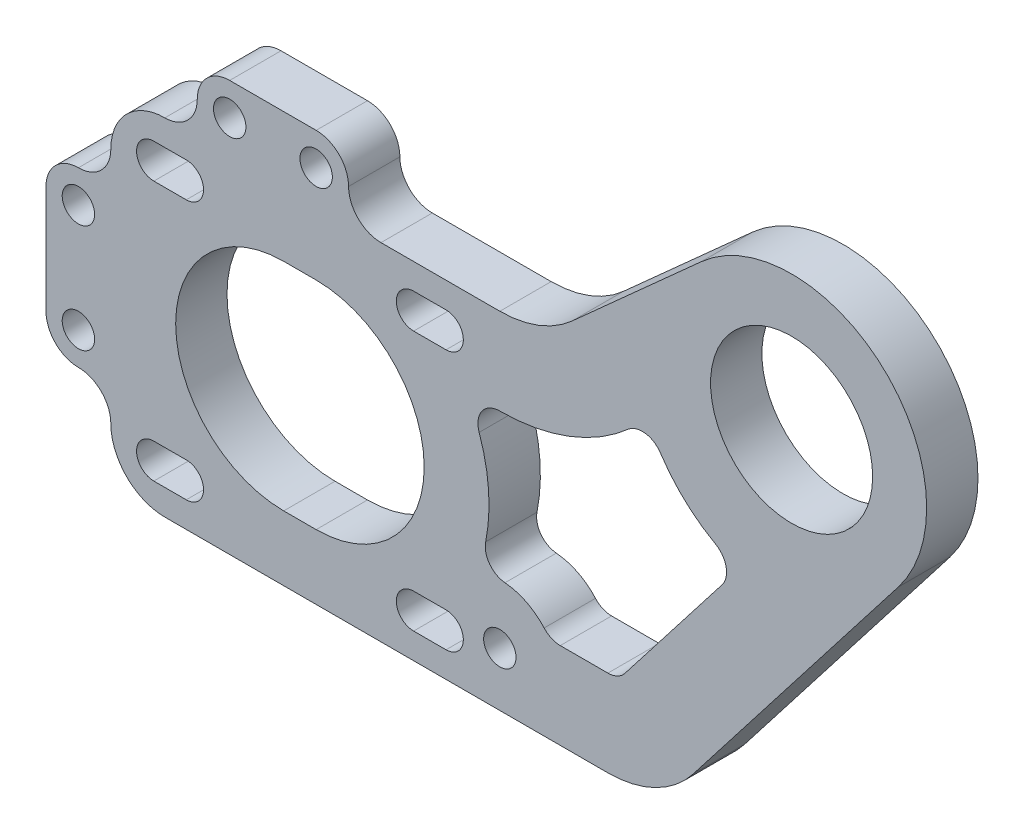
from build123d import *

# Parameters (mm, degrees)
SKETCH1_R               = 1.5
SKETCH1_R_2             = 7.5
BOSS_EXTRUDE1_DEPTH     = 2.375
CUT_EXTRUDE1_DEPTH      = 68.839078893
CUT_EXTRUDE1_DEPTH_BACK = 68.839078893


with BuildPart() as part:
    # Sketch1 → Boss-Extrude1 (new, symmetric)
    with BuildSketch(Plane.XY):
        with BuildLine():
            ThreePointArc((-11, 16), (-14.535533906, 14.535533906), (-16, 11))
            ThreePointArc((-16, 11), (-16.878679656, 8.878679656), (-19, 8))
            ThreePointArc((-19, 8), (-21.121320344, 7.121320344), (-22, 5))
            Line((-22, 5), (-22, -5))
            ThreePointArc((-22, -5), (-21.121320344, -7.121320344), (-19, -8))
            ThreePointArc((-19, -8), (-16.878679656, -8.878679656), (-16, -11))
            ThreePointArc((-16, -11), (-14.535533906, -14.535533906), (-11, -16))
            Line((-11, -16), (30, -16))
            ThreePointArc((30, -16), (34.39981922, -14.980066304), (37.902133665, -12.128318166))
            Line((37.902133665, -12.128318166), (56.877667081, 12.339602293))
            ThreePointArc((56.877667081, 12.339602293), (55.515808728, 29.150464562), (38.650559602, 29.30251821))
            Line((38.650559602, 29.30251821), (26.679552318, 18.557985432))
            ThreePointArc((26.679552318, 18.557985432), (23.576300765, 16.66136665), (20, 16))
            Line((20, 16), (9, 16))
            ThreePointArc((9, 16), (6.878679656, 16.878679656), (6, 19))
            ThreePointArc((6, 19), (5.121320344, 21.121320344), (3, 22))
            Line((3, 22), (-5, 22))
            ThreePointArc((-5, 22), (-7.121320344, 21.121320344), (-8, 19))
            ThreePointArc((-8, 19), (-8.878679656, 16.878679656), (-11, 16))
        make_face()
        with BuildLine():
            ThreePointArc((0, -10), (-10, 0), (0, 10))
            Line((0, 10), (3, 10))
            ThreePointArc((3, 10), (13, 0), (3, -10))
            Line((3, -10), (0, -10))
        make_face(mode=Mode.SUBTRACT)
        with Locations((20, -11)):
            Circle(SKETCH1_R, mode=Mode.SUBTRACT)
        with BuildLine():
            Line((40.560975696, 4.354266843), (31.580426733, -7.225663633))
            ThreePointArc((31.580426733, -7.225663633), (30.879963844, -7.796013261), (30, -8))
            Line((30, -8), (25.590169944, -8))
            ThreePointArc((25.590169944, -8), (24.773673363, -7.825741858), (24.099457959, -7.333333333))
            ThreePointArc((24.099457959, -7.333333333), (22.461292287, -6.081459538), (20.47726218, -5.520746327))
            ThreePointArc((20.47726218, -5.520746327), (19.050581882, -4.727983476), (18.689610724, -3.136258174))
            ThreePointArc((18.689610724, -3.136258174), (18.959379998, 1.139381444), (18.084944665, 5.333333333))
            ThreePointArc((18.084944665, 5.333333333), (18.337569587, 7.154700538), (19.970562748, 8))
            Line((19.970562748, 8), (20, 8))
            ThreePointArc((20, 8), (26.437341377, 9.190459971), (32.023194173, 12.604373778))
            Line((32.023194173, 12.604373778), (31.856643012, 12.454886407))
            ThreePointArc((31.856643012, 12.454886407), (33.451803609, 12.949609654), (34.866183357, 12.061455191))
            ThreePointArc((34.866183357, 12.061455191), (37.121661875, 9.385461108), (39.952603634, 7.327817691))
            ThreePointArc((39.952603634, 7.327817691), (40.93995997, 5.980815134), (40.560975696, 4.354266843))
        make_face(mode=Mode.SUBTRACT)
        with Locations((3, 19)):
            Circle(SKETCH1_R, mode=Mode.SUBTRACT)
        with Locations((-5, 19)):
            Circle(SKETCH1_R, mode=Mode.SUBTRACT)
        with Locations((47, 20)):
            Circle(SKETCH1_R_2, mode=Mode.SUBTRACT)
        with Locations((-19, 5)):
            Circle(SKETCH1_R, mode=Mode.SUBTRACT)
        with Locations((-19, -5)):
            Circle(SKETCH1_R, mode=Mode.SUBTRACT)
    extrude(amount=BOSS_EXTRUDE1_DEPTH, both=True)

    # Sketch2 → Cut-Extrude1 (cut, two sides: drawn at the far end of the back side and taken through both)
    with BuildSketch(Plane.XY.offset(-CUT_EXTRUDE1_DEPTH_BACK)):
        with BuildLine():
            Line((-12.02081528, 13.62081528), (-9.02081528, 13.62081528))
            ThreePointArc((-9.02081528, 13.62081528), (-7.42081528, 12.02081528), (-9.02081528, 10.42081528))
            Line((-9.02081528, 10.42081528), (-12.02081528, 10.42081528))
            ThreePointArc((-12.02081528, 10.42081528), (-13.62081528, 12.02081528), (-12.02081528, 13.62081528))
        make_face()
        with BuildLine():
            Line((12.02081528, 13.62081528), (15.02081528, 13.62081528))
            ThreePointArc((15.02081528, 13.62081528), (16.62081528, 12.02081528), (15.02081528, 10.42081528))
            Line((15.02081528, 10.42081528), (12.02081528, 10.42081528))
            ThreePointArc((12.02081528, 10.42081528), (10.42081528, 12.02081528), (12.02081528, 13.62081528))
        make_face()
        with BuildLine():
            Line((-12.02081528, -10.42081528), (-9.02081528, -10.42081528))
            ThreePointArc((-9.02081528, -10.42081528), (-7.42081528, -12.02081528), (-9.02081528, -13.62081528))
            Line((-9.02081528, -13.62081528), (-12.02081528, -13.62081528))
            ThreePointArc((-12.02081528, -13.62081528), (-13.62081528, -12.02081528), (-12.02081528, -10.42081528))
        make_face()
        with BuildLine():
            Line((12.02081528, -10.42081528), (15.02081528, -10.42081528))
            ThreePointArc((15.02081528, -10.42081528), (16.62081528, -12.02081528), (15.02081528, -13.62081528))
            Line((15.02081528, -13.62081528), (12.02081528, -13.62081528))
            ThreePointArc((12.02081528, -13.62081528), (10.42081528, -12.02081528), (12.02081528, -10.42081528))
        make_face()
    extrude(amount=CUT_EXTRUDE1_DEPTH + CUT_EXTRUDE1_DEPTH_BACK, mode=Mode.SUBTRACT)


solid = part.part
